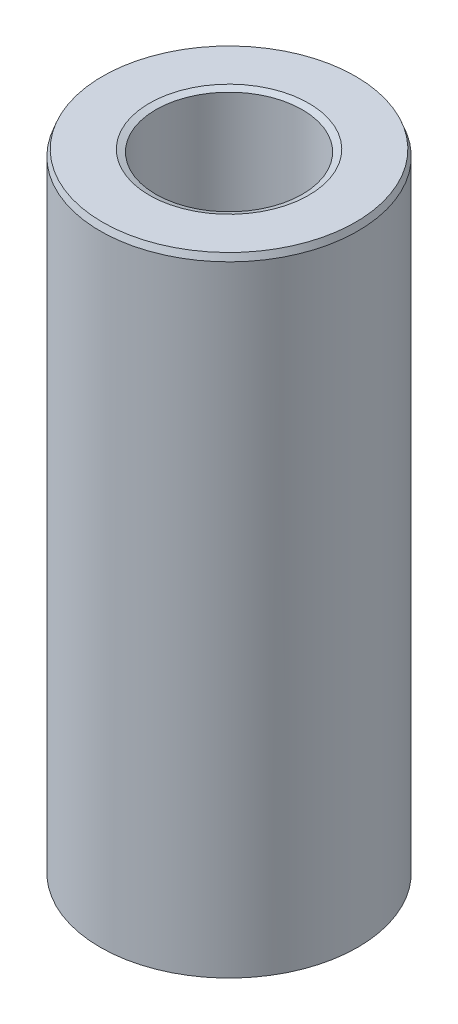
from build123d import *
from OCP.BRepFilletAPI import BRepFilletAPI_MakeChamfer

# Parameters (mm, degrees)
SKETCH1_R           = 25
BOSS_EXTRUDE1_DEPTH = 122.052677731
SKETCH2_R           = 14.219769782
CUT_EXTRUDE1_DEPTH  = 128.070280323
CHAMFER1_SIZE       = 1.247962898
CHAMFER1_SIZE2      = 0.462022938


with BuildPart() as part:
    # Sketch1 → Boss-Extrude1 (new body)
    with BuildSketch(Plane(origin=(0, 0, 0), x_dir=(1, 0, 0), z_dir=(0, 1, 0))):
        Circle(SKETCH1_R)
    extrude(amount=BOSS_EXTRUDE1_DEPTH)

    # Sketch2 → Cut-Extrude1 (cut, through all)
    with BuildSketch(Plane(origin=(0, 0, 0), x_dir=(1, 0, 0), z_dir=(0, 1, 0))):
        Circle(SKETCH2_R)
    extrude(amount=CUT_EXTRUDE1_DEPTH, mode=Mode.SUBTRACT)

    # Chamfer1: one chamfer whose edges measure the first distance from different faces: ONE call of the kernel's chamfer builder (chamfer() names one face for all edges)
    chamfer1_edges_1 = [part.edges().sort_by_distance(p)[0] for p in [
        (-14.219769782, 122.052677731, 0),
    ]]
    chamfer1_side_1 = [part.faces().sort_by_distance(p)[0] for p in [
        (-24.292893219, 122.052677731, 0),
    ]]
    chamfer1_edges_2 = [part.edges().sort_by_distance(p)[0] for p in [
        (-14.219769782, 0, 0),
    ]]
    chamfer1_side_2 = [part.faces().sort_by_distance(p)[0] for p in [
        (-14.219769782, 61.026338866, 0),
    ]]
    chamfer1_edges_3 = [part.edges().sort_by_distance(p)[0] for p in [
        (-25, 0, 0),
    ]]
    chamfer1_side_3 = [part.faces().sort_by_distance(p)[0] for p in [
        (-24.292893219, 0, 0),
    ]]
    chamfer1_edges_4 = [part.edges().sort_by_distance(p)[0] for p in [
        (-25, 122.052677731, 0),
    ]]
    chamfer1_side_4 = [part.faces().sort_by_distance(p)[0] for p in [
        (-25, 61.026338866, 0),
    ]]
    chamfer1 = BRepFilletAPI_MakeChamfer(part.part.solid().wrapped)
    for e in chamfer1_edges_1:
        chamfer1.Add(CHAMFER1_SIZE, CHAMFER1_SIZE2, e.wrapped, chamfer1_side_1[0].wrapped)  # the first distance lies on this face
    for e in chamfer1_edges_2:
        chamfer1.Add(CHAMFER1_SIZE, CHAMFER1_SIZE2, e.wrapped, chamfer1_side_2[0].wrapped)  # the first distance lies on this face
    for e in chamfer1_edges_3:
        chamfer1.Add(CHAMFER1_SIZE, CHAMFER1_SIZE2, e.wrapped, chamfer1_side_3[0].wrapped)  # the first distance lies on this face
    for e in chamfer1_edges_4:
        chamfer1.Add(CHAMFER1_SIZE, CHAMFER1_SIZE2, e.wrapped, chamfer1_side_4[0].wrapped)  # the first distance lies on this face
    add(Compound.cast(chamfer1.Shape()), mode=Mode.REPLACE)


solid = part.part
